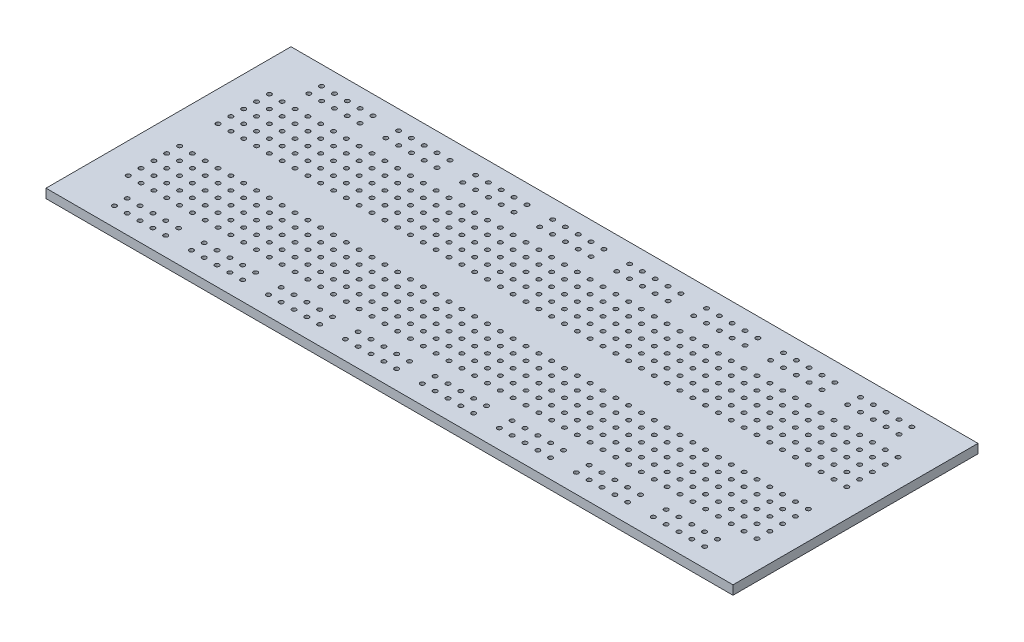
from build123d import *

# Parameters (mm, degrees)
CROQUIS1_W              = 136
CROQUIS1_H              = 48.5
CROQUIS1_R              = 0.425
SALIENTE_EXTRUIR1_DEPTH = 1.8


with BuildPart() as part:
    # Croquis1 → Saliente-Extruir1 (new body)
    with BuildSketch(Plane(origin=(0, 0, 0), x_dir=(1, 0, 0), z_dir=(0, 1, 0))):
        with Locations((68, 24.25)):
            Rectangle(CROQUIS1_W, CROQUIS1_H)
        with Locations((6, 28.06)):
            Circle(CROQUIS1_R, mode=Mode.SUBTRACT)
        with Locations((8.54, 28.06)):
            Circle(CROQUIS1_R, mode=Mode.SUBTRACT)
        with Locations((11.08, 28.06)):
            Circle(CROQUIS1_R, mode=Mode.SUBTRACT)
        with Locations((13.62, 28.06)):
            Circle(CROQUIS1_R, mode=Mode.SUBTRACT)
        with Locations((16.16, 28.06)):
            Circle(CROQUIS1_R, mode=Mode.SUBTRACT)
        with Locations((18.7, 28.06)):
            Circle(CROQUIS1_R, mode=Mode.SUBTRACT)
        with Locations((21.24, 28.06)):
            Circle(CROQUIS1_R, mode=Mode.SUBTRACT)
        with Locations((23.78, 28.06)):
            Circle(CROQUIS1_R, mode=Mode.SUBTRACT)
        with Locations((26.32, 28.06)):
            Circle(CROQUIS1_R, mode=Mode.SUBTRACT)
        with Locations((28.86, 28.06)):
            Circle(CROQUIS1_R, mode=Mode.SUBTRACT)
        with Locations((31.4, 28.06)):
            Circle(CROQUIS1_R, mode=Mode.SUBTRACT)
        with Locations((33.94, 28.06)):
            Circle(CROQUIS1_R, mode=Mode.SUBTRACT)
        with Locations((36.48, 28.06)):
            Circle(CROQUIS1_R, mode=Mode.SUBTRACT)
        with Locations((39.02, 28.06)):
            Circle(CROQUIS1_R, mode=Mode.SUBTRACT)
        with Locations((41.56, 28.06)):
            Circle(CROQUIS1_R, mode=Mode.SUBTRACT)
        with Locations((44.1, 28.06)):
            Circle(CROQUIS1_R, mode=Mode.SUBTRACT)
        with Locations((46.64, 28.06)):
            Circle(CROQUIS1_R, mode=Mode.SUBTRACT)
        with Locations((49.18, 28.06)):
            Circle(CROQUIS1_R, mode=Mode.SUBTRACT)
        with Locations((51.72, 28.06)):
            Circle(CROQUIS1_R, mode=Mode.SUBTRACT)
        with Locations((54.26, 28.06)):
            Circle(CROQUIS1_R, mode=Mode.SUBTRACT)
        with Locations((56.8, 28.06)):
            Circle(CROQUIS1_R, mode=Mode.SUBTRACT)
        with Locations((59.34, 28.06)):
            Circle(CROQUIS1_R, mode=Mode.SUBTRACT)
        with Locations((61.88, 28.06)):
            Circle(CROQUIS1_R, mode=Mode.SUBTRACT)
        with Locations((64.42, 28.06)):
            Circle(CROQUIS1_R, mode=Mode.SUBTRACT)
        with Locations((66.96, 28.06)):
            Circle(CROQUIS1_R, mode=Mode.SUBTRACT)
        with Locations((69.5, 28.06)):
            Circle(CROQUIS1_R, mode=Mode.SUBTRACT)
        with Locations((72.04, 28.06)):
            Circle(CROQUIS1_R, mode=Mode.SUBTRACT)
        with Locations((74.58, 28.06)):
            Circle(CROQUIS1_R, mode=Mode.SUBTRACT)
        with Locations((77.12, 28.06)):
            Circle(CROQUIS1_R, mode=Mode.SUBTRACT)
        with Locations((79.66, 28.06)):
            Circle(CROQUIS1_R, mode=Mode.SUBTRACT)
        with Locations((82.2, 28.06)):
            Circle(CROQUIS1_R, mode=Mode.SUBTRACT)
        with Locations((84.74, 28.06)):
            Circle(CROQUIS1_R, mode=Mode.SUBTRACT)
        with Locations((87.28, 28.06)):
            Circle(CROQUIS1_R, mode=Mode.SUBTRACT)
        with Locations((89.82, 28.06)):
            Circle(CROQUIS1_R, mode=Mode.SUBTRACT)
        with Locations((92.36, 28.06)):
            Circle(CROQUIS1_R, mode=Mode.SUBTRACT)
        with Locations((94.9, 28.06)):
            Circle(CROQUIS1_R, mode=Mode.SUBTRACT)
        with Locations((97.44, 28.06)):
            Circle(CROQUIS1_R, mode=Mode.SUBTRACT)
        with Locations((99.98, 28.06)):
            Circle(CROQUIS1_R, mode=Mode.SUBTRACT)
        with Locations((102.52, 28.06)):
            Circle(CROQUIS1_R, mode=Mode.SUBTRACT)
        with Locations((105.06, 28.06)):
            Circle(CROQUIS1_R, mode=Mode.SUBTRACT)
        with Locations((107.6, 28.06)):
            Circle(CROQUIS1_R, mode=Mode.SUBTRACT)
        with Locations((110.14, 28.06)):
            Circle(CROQUIS1_R, mode=Mode.SUBTRACT)
        with Locations((112.68, 28.06)):
            Circle(CROQUIS1_R, mode=Mode.SUBTRACT)
        with Locations((115.22, 28.06)):
            Circle(CROQUIS1_R, mode=Mode.SUBTRACT)
        with Locations((117.76, 28.06)):
            Circle(CROQUIS1_R, mode=Mode.SUBTRACT)
        with Locations((120.3, 28.06)):
            Circle(CROQUIS1_R, mode=Mode.SUBTRACT)
        with Locations((122.84, 28.06)):
            Circle(CROQUIS1_R, mode=Mode.SUBTRACT)
        with Locations((125.38, 28.06)):
            Circle(CROQUIS1_R, mode=Mode.SUBTRACT)
        with Locations((127.92, 28.06)):
            Circle(CROQUIS1_R, mode=Mode.SUBTRACT)
        with Locations((130.46, 28.06)):
            Circle(CROQUIS1_R, mode=Mode.SUBTRACT)
        with Locations((8.54, 30.6)):
            Circle(CROQUIS1_R, mode=Mode.SUBTRACT)
        with Locations((11.08, 30.6)):
            Circle(CROQUIS1_R, mode=Mode.SUBTRACT)
        with Locations((13.62, 30.6)):
            Circle(CROQUIS1_R, mode=Mode.SUBTRACT)
        with Locations((16.16, 30.6)):
            Circle(CROQUIS1_R, mode=Mode.SUBTRACT)
        with Locations((18.7, 30.6)):
            Circle(CROQUIS1_R, mode=Mode.SUBTRACT)
        with Locations((21.24, 30.6)):
            Circle(CROQUIS1_R, mode=Mode.SUBTRACT)
        with Locations((23.78, 30.6)):
            Circle(CROQUIS1_R, mode=Mode.SUBTRACT)
        with Locations((26.32, 30.6)):
            Circle(CROQUIS1_R, mode=Mode.SUBTRACT)
        with Locations((28.86, 30.6)):
            Circle(CROQUIS1_R, mode=Mode.SUBTRACT)
        with Locations((31.4, 30.6)):
            Circle(CROQUIS1_R, mode=Mode.SUBTRACT)
        with Locations((33.94, 30.6)):
            Circle(CROQUIS1_R, mode=Mode.SUBTRACT)
        with Locations((36.48, 30.6)):
            Circle(CROQUIS1_R, mode=Mode.SUBTRACT)
        with Locations((39.02, 30.6)):
            Circle(CROQUIS1_R, mode=Mode.SUBTRACT)
        with Locations((41.56, 30.6)):
            Circle(CROQUIS1_R, mode=Mode.SUBTRACT)
        with Locations((44.1, 30.6)):
            Circle(CROQUIS1_R, mode=Mode.SUBTRACT)
        with Locations((46.64, 30.6)):
            Circle(CROQUIS1_R, mode=Mode.SUBTRACT)
        with Locations((49.18, 30.6)):
            Circle(CROQUIS1_R, mode=Mode.SUBTRACT)
        with Locations((51.72, 30.6)):
            Circle(CROQUIS1_R, mode=Mode.SUBTRACT)
        with Locations((54.26, 30.6)):
            Circle(CROQUIS1_R, mode=Mode.SUBTRACT)
        with Locations((56.8, 30.6)):
            Circle(CROQUIS1_R, mode=Mode.SUBTRACT)
        with Locations((59.34, 30.6)):
            Circle(CROQUIS1_R, mode=Mode.SUBTRACT)
        with Locations((61.88, 30.6)):
            Circle(CROQUIS1_R, mode=Mode.SUBTRACT)
        with Locations((64.42, 30.6)):
            Circle(CROQUIS1_R, mode=Mode.SUBTRACT)
        with Locations((66.96, 30.6)):
            Circle(CROQUIS1_R, mode=Mode.SUBTRACT)
        with Locations((69.5, 30.6)):
            Circle(CROQUIS1_R, mode=Mode.SUBTRACT)
        with Locations((72.04, 30.6)):
            Circle(CROQUIS1_R, mode=Mode.SUBTRACT)
        with Locations((74.58, 30.6)):
            Circle(CROQUIS1_R, mode=Mode.SUBTRACT)
        with Locations((77.12, 30.6)):
            Circle(CROQUIS1_R, mode=Mode.SUBTRACT)
        with Locations((79.66, 30.6)):
            Circle(CROQUIS1_R, mode=Mode.SUBTRACT)
        with Locations((82.2, 30.6)):
            Circle(CROQUIS1_R, mode=Mode.SUBTRACT)
        with Locations((84.74, 30.6)):
            Circle(CROQUIS1_R, mode=Mode.SUBTRACT)
        with Locations((87.28, 30.6)):
            Circle(CROQUIS1_R, mode=Mode.SUBTRACT)
        with Locations((89.82, 30.6)):
            Circle(CROQUIS1_R, mode=Mode.SUBTRACT)
        with Locations((92.36, 30.6)):
            Circle(CROQUIS1_R, mode=Mode.SUBTRACT)
        with Locations((94.9, 30.6)):
            Circle(CROQUIS1_R, mode=Mode.SUBTRACT)
        with Locations((97.44, 30.6)):
            Circle(CROQUIS1_R, mode=Mode.SUBTRACT)
        with Locations((99.98, 30.6)):
            Circle(CROQUIS1_R, mode=Mode.SUBTRACT)
        with Locations((102.52, 30.6)):
            Circle(CROQUIS1_R, mode=Mode.SUBTRACT)
        with Locations((105.06, 30.6)):
            Circle(CROQUIS1_R, mode=Mode.SUBTRACT)
        with Locations((107.6, 30.6)):
            Circle(CROQUIS1_R, mode=Mode.SUBTRACT)
        with Locations((110.14, 30.6)):
            Circle(CROQUIS1_R, mode=Mode.SUBTRACT)
        with Locations((112.68, 30.6)):
            Circle(CROQUIS1_R, mode=Mode.SUBTRACT)
        with Locations((115.22, 30.6)):
            Circle(CROQUIS1_R, mode=Mode.SUBTRACT)
        with Locations((117.76, 30.6)):
            Circle(CROQUIS1_R, mode=Mode.SUBTRACT)
        with Locations((120.3, 30.6)):
            Circle(CROQUIS1_R, mode=Mode.SUBTRACT)
        with Locations((122.84, 30.6)):
            Circle(CROQUIS1_R, mode=Mode.SUBTRACT)
        with Locations((125.38, 30.6)):
            Circle(CROQUIS1_R, mode=Mode.SUBTRACT)
        with Locations((127.92, 30.6)):
            Circle(CROQUIS1_R, mode=Mode.SUBTRACT)
        with Locations((130.46, 30.6)):
            Circle(CROQUIS1_R, mode=Mode.SUBTRACT)
        with Locations((8.54, 33.14)):
            Circle(CROQUIS1_R, mode=Mode.SUBTRACT)
        with Locations((11.08, 33.14)):
            Circle(CROQUIS1_R, mode=Mode.SUBTRACT)
        with Locations((13.62, 33.14)):
            Circle(CROQUIS1_R, mode=Mode.SUBTRACT)
        with Locations((16.16, 33.14)):
            Circle(CROQUIS1_R, mode=Mode.SUBTRACT)
        with Locations((18.7, 33.14)):
            Circle(CROQUIS1_R, mode=Mode.SUBTRACT)
        with Locations((21.24, 33.14)):
            Circle(CROQUIS1_R, mode=Mode.SUBTRACT)
        with Locations((23.78, 33.14)):
            Circle(CROQUIS1_R, mode=Mode.SUBTRACT)
        with Locations((26.32, 33.14)):
            Circle(CROQUIS1_R, mode=Mode.SUBTRACT)
        with Locations((28.86, 33.14)):
            Circle(CROQUIS1_R, mode=Mode.SUBTRACT)
        with Locations((31.4, 33.14)):
            Circle(CROQUIS1_R, mode=Mode.SUBTRACT)
        with Locations((33.94, 33.14)):
            Circle(CROQUIS1_R, mode=Mode.SUBTRACT)
        with Locations((36.48, 33.14)):
            Circle(CROQUIS1_R, mode=Mode.SUBTRACT)
        with Locations((39.02, 33.14)):
            Circle(CROQUIS1_R, mode=Mode.SUBTRACT)
        with Locations((41.56, 33.14)):
            Circle(CROQUIS1_R, mode=Mode.SUBTRACT)
        with Locations((44.1, 33.14)):
            Circle(CROQUIS1_R, mode=Mode.SUBTRACT)
        with Locations((46.64, 33.14)):
            Circle(CROQUIS1_R, mode=Mode.SUBTRACT)
        with Locations((49.18, 33.14)):
            Circle(CROQUIS1_R, mode=Mode.SUBTRACT)
        with Locations((51.72, 33.14)):
            Circle(CROQUIS1_R, mode=Mode.SUBTRACT)
        with Locations((54.26, 33.14)):
            Circle(CROQUIS1_R, mode=Mode.SUBTRACT)
        with Locations((56.8, 33.14)):
            Circle(CROQUIS1_R, mode=Mode.SUBTRACT)
        with Locations((59.34, 33.14)):
            Circle(CROQUIS1_R, mode=Mode.SUBTRACT)
        with Locations((61.88, 33.14)):
            Circle(CROQUIS1_R, mode=Mode.SUBTRACT)
        with Locations((64.42, 33.14)):
            Circle(CROQUIS1_R, mode=Mode.SUBTRACT)
        with Locations((66.96, 33.14)):
            Circle(CROQUIS1_R, mode=Mode.SUBTRACT)
        with Locations((69.5, 33.14)):
            Circle(CROQUIS1_R, mode=Mode.SUBTRACT)
        with Locations((72.04, 33.14)):
            Circle(CROQUIS1_R, mode=Mode.SUBTRACT)
        with Locations((74.58, 33.14)):
            Circle(CROQUIS1_R, mode=Mode.SUBTRACT)
        with Locations((77.12, 33.14)):
            Circle(CROQUIS1_R, mode=Mode.SUBTRACT)
        with Locations((79.66, 33.14)):
            Circle(CROQUIS1_R, mode=Mode.SUBTRACT)
        with Locations((82.2, 33.14)):
            Circle(CROQUIS1_R, mode=Mode.SUBTRACT)
        with Locations((84.74, 33.14)):
            Circle(CROQUIS1_R, mode=Mode.SUBTRACT)
        with Locations((87.28, 33.14)):
            Circle(CROQUIS1_R, mode=Mode.SUBTRACT)
        with Locations((89.82, 33.14)):
            Circle(CROQUIS1_R, mode=Mode.SUBTRACT)
        with Locations((92.36, 33.14)):
            Circle(CROQUIS1_R, mode=Mode.SUBTRACT)
        with Locations((94.9, 33.14)):
            Circle(CROQUIS1_R, mode=Mode.SUBTRACT)
        with Locations((97.44, 33.14)):
            Circle(CROQUIS1_R, mode=Mode.SUBTRACT)
        with Locations((99.98, 33.14)):
            Circle(CROQUIS1_R, mode=Mode.SUBTRACT)
        with Locations((102.52, 33.14)):
            Circle(CROQUIS1_R, mode=Mode.SUBTRACT)
        with Locations((105.06, 33.14)):
            Circle(CROQUIS1_R, mode=Mode.SUBTRACT)
        with Locations((107.6, 33.14)):
            Circle(CROQUIS1_R, mode=Mode.SUBTRACT)
        with Locations((110.14, 33.14)):
            Circle(CROQUIS1_R, mode=Mode.SUBTRACT)
        with Locations((112.68, 33.14)):
            Circle(CROQUIS1_R, mode=Mode.SUBTRACT)
        with Locations((115.22, 33.14)):
            Circle(CROQUIS1_R, mode=Mode.SUBTRACT)
        with Locations((117.76, 33.14)):
            Circle(CROQUIS1_R, mode=Mode.SUBTRACT)
        with Locations((120.3, 33.14)):
            Circle(CROQUIS1_R, mode=Mode.SUBTRACT)
        with Locations((122.84, 33.14)):
            Circle(CROQUIS1_R, mode=Mode.SUBTRACT)
        with Locations((125.38, 33.14)):
            Circle(CROQUIS1_R, mode=Mode.SUBTRACT)
        with Locations((127.92, 33.14)):
            Circle(CROQUIS1_R, mode=Mode.SUBTRACT)
        with Locations((130.46, 33.14)):
            Circle(CROQUIS1_R, mode=Mode.SUBTRACT)
        with Locations((8.54, 35.68)):
            Circle(CROQUIS1_R, mode=Mode.SUBTRACT)
        with Locations((11.08, 35.68)):
            Circle(CROQUIS1_R, mode=Mode.SUBTRACT)
        with Locations((13.62, 35.68)):
            Circle(CROQUIS1_R, mode=Mode.SUBTRACT)
        with Locations((16.16, 35.68)):
            Circle(CROQUIS1_R, mode=Mode.SUBTRACT)
        with Locations((18.7, 35.68)):
            Circle(CROQUIS1_R, mode=Mode.SUBTRACT)
        with Locations((21.24, 35.68)):
            Circle(CROQUIS1_R, mode=Mode.SUBTRACT)
        with Locations((23.78, 35.68)):
            Circle(CROQUIS1_R, mode=Mode.SUBTRACT)
        with Locations((26.32, 35.68)):
            Circle(CROQUIS1_R, mode=Mode.SUBTRACT)
        with Locations((28.86, 35.68)):
            Circle(CROQUIS1_R, mode=Mode.SUBTRACT)
        with Locations((31.4, 35.68)):
            Circle(CROQUIS1_R, mode=Mode.SUBTRACT)
        with Locations((33.94, 35.68)):
            Circle(CROQUIS1_R, mode=Mode.SUBTRACT)
        with Locations((36.48, 35.68)):
            Circle(CROQUIS1_R, mode=Mode.SUBTRACT)
        with Locations((39.02, 35.68)):
            Circle(CROQUIS1_R, mode=Mode.SUBTRACT)
        with Locations((41.56, 35.68)):
            Circle(CROQUIS1_R, mode=Mode.SUBTRACT)
        with Locations((44.1, 35.68)):
            Circle(CROQUIS1_R, mode=Mode.SUBTRACT)
        with Locations((46.64, 35.68)):
            Circle(CROQUIS1_R, mode=Mode.SUBTRACT)
        with Locations((49.18, 35.68)):
            Circle(CROQUIS1_R, mode=Mode.SUBTRACT)
        with Locations((51.72, 35.68)):
            Circle(CROQUIS1_R, mode=Mode.SUBTRACT)
        with Locations((54.26, 35.68)):
            Circle(CROQUIS1_R, mode=Mode.SUBTRACT)
        with Locations((56.8, 35.68)):
            Circle(CROQUIS1_R, mode=Mode.SUBTRACT)
        with Locations((59.34, 35.68)):
            Circle(CROQUIS1_R, mode=Mode.SUBTRACT)
        with Locations((61.88, 35.68)):
            Circle(CROQUIS1_R, mode=Mode.SUBTRACT)
        with Locations((64.42, 35.68)):
            Circle(CROQUIS1_R, mode=Mode.SUBTRACT)
        with Locations((66.96, 35.68)):
            Circle(CROQUIS1_R, mode=Mode.SUBTRACT)
        with Locations((69.5, 35.68)):
            Circle(CROQUIS1_R, mode=Mode.SUBTRACT)
        with Locations((72.04, 35.68)):
            Circle(CROQUIS1_R, mode=Mode.SUBTRACT)
        with Locations((74.58, 35.68)):
            Circle(CROQUIS1_R, mode=Mode.SUBTRACT)
        with Locations((77.12, 35.68)):
            Circle(CROQUIS1_R, mode=Mode.SUBTRACT)
        with Locations((79.66, 35.68)):
            Circle(CROQUIS1_R, mode=Mode.SUBTRACT)
        with Locations((82.2, 35.68)):
            Circle(CROQUIS1_R, mode=Mode.SUBTRACT)
        with Locations((84.74, 35.68)):
            Circle(CROQUIS1_R, mode=Mode.SUBTRACT)
        with Locations((87.28, 35.68)):
            Circle(CROQUIS1_R, mode=Mode.SUBTRACT)
        with Locations((89.82, 35.68)):
            Circle(CROQUIS1_R, mode=Mode.SUBTRACT)
        with Locations((92.36, 35.68)):
            Circle(CROQUIS1_R, mode=Mode.SUBTRACT)
        with Locations((94.9, 35.68)):
            Circle(CROQUIS1_R, mode=Mode.SUBTRACT)
        with Locations((97.44, 35.68)):
            Circle(CROQUIS1_R, mode=Mode.SUBTRACT)
        with Locations((99.98, 35.68)):
            Circle(CROQUIS1_R, mode=Mode.SUBTRACT)
        with Locations((102.52, 35.68)):
            Circle(CROQUIS1_R, mode=Mode.SUBTRACT)
        with Locations((105.06, 35.68)):
            Circle(CROQUIS1_R, mode=Mode.SUBTRACT)
        with Locations((107.6, 35.68)):
            Circle(CROQUIS1_R, mode=Mode.SUBTRACT)
        with Locations((110.14, 35.68)):
            Circle(CROQUIS1_R, mode=Mode.SUBTRACT)
        with Locations((112.68, 35.68)):
            Circle(CROQUIS1_R, mode=Mode.SUBTRACT)
        with Locations((115.22, 35.68)):
            Circle(CROQUIS1_R, mode=Mode.SUBTRACT)
        with Locations((117.76, 35.68)):
            Circle(CROQUIS1_R, mode=Mode.SUBTRACT)
        with Locations((120.3, 35.68)):
            Circle(CROQUIS1_R, mode=Mode.SUBTRACT)
        with Locations((122.84, 35.68)):
            Circle(CROQUIS1_R, mode=Mode.SUBTRACT)
        with Locations((125.38, 35.68)):
            Circle(CROQUIS1_R, mode=Mode.SUBTRACT)
        with Locations((127.92, 35.68)):
            Circle(CROQUIS1_R, mode=Mode.SUBTRACT)
        with Locations((130.46, 35.68)):
            Circle(CROQUIS1_R, mode=Mode.SUBTRACT)
        with Locations((8.54, 38.22)):
            Circle(CROQUIS1_R, mode=Mode.SUBTRACT)
        with Locations((11.08, 38.22)):
            Circle(CROQUIS1_R, mode=Mode.SUBTRACT)
        with Locations((13.62, 38.22)):
            Circle(CROQUIS1_R, mode=Mode.SUBTRACT)
        with Locations((16.16, 38.22)):
            Circle(CROQUIS1_R, mode=Mode.SUBTRACT)
        with Locations((18.7, 38.22)):
            Circle(CROQUIS1_R, mode=Mode.SUBTRACT)
        with Locations((21.24, 38.22)):
            Circle(CROQUIS1_R, mode=Mode.SUBTRACT)
        with Locations((23.78, 38.22)):
            Circle(CROQUIS1_R, mode=Mode.SUBTRACT)
        with Locations((26.32, 38.22)):
            Circle(CROQUIS1_R, mode=Mode.SUBTRACT)
        with Locations((28.86, 38.22)):
            Circle(CROQUIS1_R, mode=Mode.SUBTRACT)
        with Locations((31.4, 38.22)):
            Circle(CROQUIS1_R, mode=Mode.SUBTRACT)
        with Locations((33.94, 38.22)):
            Circle(CROQUIS1_R, mode=Mode.SUBTRACT)
        with Locations((36.48, 38.22)):
            Circle(CROQUIS1_R, mode=Mode.SUBTRACT)
        with Locations((39.02, 38.22)):
            Circle(CROQUIS1_R, mode=Mode.SUBTRACT)
        with Locations((41.56, 38.22)):
            Circle(CROQUIS1_R, mode=Mode.SUBTRACT)
        with Locations((44.1, 38.22)):
            Circle(CROQUIS1_R, mode=Mode.SUBTRACT)
        with Locations((46.64, 38.22)):
            Circle(CROQUIS1_R, mode=Mode.SUBTRACT)
        with Locations((49.18, 38.22)):
            Circle(CROQUIS1_R, mode=Mode.SUBTRACT)
        with Locations((51.72, 38.22)):
            Circle(CROQUIS1_R, mode=Mode.SUBTRACT)
        with Locations((54.26, 38.22)):
            Circle(CROQUIS1_R, mode=Mode.SUBTRACT)
        with Locations((56.8, 38.22)):
            Circle(CROQUIS1_R, mode=Mode.SUBTRACT)
        with Locations((59.34, 38.22)):
            Circle(CROQUIS1_R, mode=Mode.SUBTRACT)
        with Locations((61.88, 38.22)):
            Circle(CROQUIS1_R, mode=Mode.SUBTRACT)
        with Locations((64.42, 38.22)):
            Circle(CROQUIS1_R, mode=Mode.SUBTRACT)
        with Locations((66.96, 38.22)):
            Circle(CROQUIS1_R, mode=Mode.SUBTRACT)
        with Locations((69.5, 38.22)):
            Circle(CROQUIS1_R, mode=Mode.SUBTRACT)
        with Locations((72.04, 38.22)):
            Circle(CROQUIS1_R, mode=Mode.SUBTRACT)
        with Locations((74.58, 38.22)):
            Circle(CROQUIS1_R, mode=Mode.SUBTRACT)
        with Locations((77.12, 38.22)):
            Circle(CROQUIS1_R, mode=Mode.SUBTRACT)
        with Locations((79.66, 38.22)):
            Circle(CROQUIS1_R, mode=Mode.SUBTRACT)
        with Locations((82.2, 38.22)):
            Circle(CROQUIS1_R, mode=Mode.SUBTRACT)
        with Locations((84.74, 38.22)):
            Circle(CROQUIS1_R, mode=Mode.SUBTRACT)
        with Locations((87.28, 38.22)):
            Circle(CROQUIS1_R, mode=Mode.SUBTRACT)
        with Locations((89.82, 38.22)):
            Circle(CROQUIS1_R, mode=Mode.SUBTRACT)
        with Locations((92.36, 38.22)):
            Circle(CROQUIS1_R, mode=Mode.SUBTRACT)
        with Locations((94.9, 38.22)):
            Circle(CROQUIS1_R, mode=Mode.SUBTRACT)
        with Locations((97.44, 38.22)):
            Circle(CROQUIS1_R, mode=Mode.SUBTRACT)
        with Locations((99.98, 38.22)):
            Circle(CROQUIS1_R, mode=Mode.SUBTRACT)
        with Locations((102.52, 38.22)):
            Circle(CROQUIS1_R, mode=Mode.SUBTRACT)
        with Locations((105.06, 38.22)):
            Circle(CROQUIS1_R, mode=Mode.SUBTRACT)
        with Locations((107.6, 38.22)):
            Circle(CROQUIS1_R, mode=Mode.SUBTRACT)
        with Locations((110.14, 38.22)):
            Circle(CROQUIS1_R, mode=Mode.SUBTRACT)
        with Locations((112.68, 38.22)):
            Circle(CROQUIS1_R, mode=Mode.SUBTRACT)
        with Locations((115.22, 38.22)):
            Circle(CROQUIS1_R, mode=Mode.SUBTRACT)
        with Locations((117.76, 38.22)):
            Circle(CROQUIS1_R, mode=Mode.SUBTRACT)
        with Locations((120.3, 38.22)):
            Circle(CROQUIS1_R, mode=Mode.SUBTRACT)
        with Locations((122.84, 38.22)):
            Circle(CROQUIS1_R, mode=Mode.SUBTRACT)
        with Locations((125.38, 38.22)):
            Circle(CROQUIS1_R, mode=Mode.SUBTRACT)
        with Locations((127.92, 38.22)):
            Circle(CROQUIS1_R, mode=Mode.SUBTRACT)
        with Locations((130.46, 38.22)):
            Circle(CROQUIS1_R, mode=Mode.SUBTRACT)
        with Locations((6, 30.6)):
            Circle(CROQUIS1_R, mode=Mode.SUBTRACT)
        with Locations((6, 33.14)):
            Circle(CROQUIS1_R, mode=Mode.SUBTRACT)
        with Locations((6, 35.68)):
            Circle(CROQUIS1_R, mode=Mode.SUBTRACT)
        with Locations((6, 38.22)):
            Circle(CROQUIS1_R, mode=Mode.SUBTRACT)
        with Locations((9.8, 42.22)):
            Circle(CROQUIS1_R, mode=Mode.SUBTRACT)
        with Locations((12.34, 42.22)):
            Circle(CROQUIS1_R, mode=Mode.SUBTRACT)
        with Locations((14.88, 42.22)):
            Circle(CROQUIS1_R, mode=Mode.SUBTRACT)
        with Locations((17.42, 42.22)):
            Circle(CROQUIS1_R, mode=Mode.SUBTRACT)
        with Locations((19.96, 42.22)):
            Circle(CROQUIS1_R, mode=Mode.SUBTRACT)
        with Locations((12.34, 44.76)):
            Circle(CROQUIS1_R, mode=Mode.SUBTRACT)
        with Locations((14.88, 44.76)):
            Circle(CROQUIS1_R, mode=Mode.SUBTRACT)
        with Locations((17.42, 44.76)):
            Circle(CROQUIS1_R, mode=Mode.SUBTRACT)
        with Locations((19.96, 44.76)):
            Circle(CROQUIS1_R, mode=Mode.SUBTRACT)
        with Locations((9.8, 44.76)):
            Circle(CROQUIS1_R, mode=Mode.SUBTRACT)
        with Locations((25.04, 44.76)):
            Circle(CROQUIS1_R, mode=Mode.SUBTRACT)
        with Locations((27.58, 44.76)):
            Circle(CROQUIS1_R, mode=Mode.SUBTRACT)
        with Locations((30.12, 44.76)):
            Circle(CROQUIS1_R, mode=Mode.SUBTRACT)
        with Locations((32.66, 44.76)):
            Circle(CROQUIS1_R, mode=Mode.SUBTRACT)
        with Locations((35.2, 44.76)):
            Circle(CROQUIS1_R, mode=Mode.SUBTRACT)
        with Locations((35.2, 42.22)):
            Circle(CROQUIS1_R, mode=Mode.SUBTRACT)
        with Locations((32.66, 42.22)):
            Circle(CROQUIS1_R, mode=Mode.SUBTRACT)
        with Locations((30.12, 42.22)):
            Circle(CROQUIS1_R, mode=Mode.SUBTRACT)
        with Locations((27.58, 42.22)):
            Circle(CROQUIS1_R, mode=Mode.SUBTRACT)
        with Locations((25.04, 42.22)):
            Circle(CROQUIS1_R, mode=Mode.SUBTRACT)
        with Locations((40.28, 44.76)):
            Circle(CROQUIS1_R, mode=Mode.SUBTRACT)
        with Locations((42.82, 44.76)):
            Circle(CROQUIS1_R, mode=Mode.SUBTRACT)
        with Locations((45.36, 44.76)):
            Circle(CROQUIS1_R, mode=Mode.SUBTRACT)
        with Locations((47.9, 44.76)):
            Circle(CROQUIS1_R, mode=Mode.SUBTRACT)
        with Locations((50.44, 44.76)):
            Circle(CROQUIS1_R, mode=Mode.SUBTRACT)
        with Locations((50.44, 42.22)):
            Circle(CROQUIS1_R, mode=Mode.SUBTRACT)
        with Locations((47.9, 42.22)):
            Circle(CROQUIS1_R, mode=Mode.SUBTRACT)
        with Locations((45.36, 42.22)):
            Circle(CROQUIS1_R, mode=Mode.SUBTRACT)
        with Locations((42.82, 42.22)):
            Circle(CROQUIS1_R, mode=Mode.SUBTRACT)
        with Locations((40.28, 42.22)):
            Circle(CROQUIS1_R, mode=Mode.SUBTRACT)
        with Locations((55.52, 44.76)):
            Circle(CROQUIS1_R, mode=Mode.SUBTRACT)
        with Locations((58.06, 44.76)):
            Circle(CROQUIS1_R, mode=Mode.SUBTRACT)
        with Locations((60.6, 44.76)):
            Circle(CROQUIS1_R, mode=Mode.SUBTRACT)
        with Locations((63.14, 44.76)):
            Circle(CROQUIS1_R, mode=Mode.SUBTRACT)
        with Locations((65.68, 44.76)):
            Circle(CROQUIS1_R, mode=Mode.SUBTRACT)
        with Locations((65.68, 42.22)):
            Circle(CROQUIS1_R, mode=Mode.SUBTRACT)
        with Locations((63.14, 42.22)):
            Circle(CROQUIS1_R, mode=Mode.SUBTRACT)
        with Locations((60.6, 42.22)):
            Circle(CROQUIS1_R, mode=Mode.SUBTRACT)
        with Locations((58.06, 42.22)):
            Circle(CROQUIS1_R, mode=Mode.SUBTRACT)
        with Locations((55.52, 42.22)):
            Circle(CROQUIS1_R, mode=Mode.SUBTRACT)
        with Locations((70.76, 44.76)):
            Circle(CROQUIS1_R, mode=Mode.SUBTRACT)
        with Locations((73.3, 44.76)):
            Circle(CROQUIS1_R, mode=Mode.SUBTRACT)
        with Locations((75.84, 44.76)):
            Circle(CROQUIS1_R, mode=Mode.SUBTRACT)
        with Locations((78.38, 44.76)):
            Circle(CROQUIS1_R, mode=Mode.SUBTRACT)
        with Locations((80.92, 44.76)):
            Circle(CROQUIS1_R, mode=Mode.SUBTRACT)
        with Locations((80.92, 42.22)):
            Circle(CROQUIS1_R, mode=Mode.SUBTRACT)
        with Locations((78.38, 42.22)):
            Circle(CROQUIS1_R, mode=Mode.SUBTRACT)
        with Locations((75.84, 42.22)):
            Circle(CROQUIS1_R, mode=Mode.SUBTRACT)
        with Locations((73.3, 42.22)):
            Circle(CROQUIS1_R, mode=Mode.SUBTRACT)
        with Locations((70.76, 42.22)):
            Circle(CROQUIS1_R, mode=Mode.SUBTRACT)
        with Locations((86, 44.76)):
            Circle(CROQUIS1_R, mode=Mode.SUBTRACT)
        with Locations((88.54, 44.76)):
            Circle(CROQUIS1_R, mode=Mode.SUBTRACT)
        with Locations((91.08, 44.76)):
            Circle(CROQUIS1_R, mode=Mode.SUBTRACT)
        with Locations((93.62, 44.76)):
            Circle(CROQUIS1_R, mode=Mode.SUBTRACT)
        with Locations((96.16, 44.76)):
            Circle(CROQUIS1_R, mode=Mode.SUBTRACT)
        with Locations((96.16, 42.22)):
            Circle(CROQUIS1_R, mode=Mode.SUBTRACT)
        with Locations((93.62, 42.22)):
            Circle(CROQUIS1_R, mode=Mode.SUBTRACT)
        with Locations((91.08, 42.22)):
            Circle(CROQUIS1_R, mode=Mode.SUBTRACT)
        with Locations((88.54, 42.22)):
            Circle(CROQUIS1_R, mode=Mode.SUBTRACT)
        with Locations((86, 42.22)):
            Circle(CROQUIS1_R, mode=Mode.SUBTRACT)
        with Locations((101.24, 44.76)):
            Circle(CROQUIS1_R, mode=Mode.SUBTRACT)
        with Locations((103.78, 44.76)):
            Circle(CROQUIS1_R, mode=Mode.SUBTRACT)
        with Locations((106.32, 44.76)):
            Circle(CROQUIS1_R, mode=Mode.SUBTRACT)
        with Locations((108.86, 44.76)):
            Circle(CROQUIS1_R, mode=Mode.SUBTRACT)
        with Locations((111.4, 44.76)):
            Circle(CROQUIS1_R, mode=Mode.SUBTRACT)
        with Locations((111.4, 42.22)):
            Circle(CROQUIS1_R, mode=Mode.SUBTRACT)
        with Locations((108.86, 42.22)):
            Circle(CROQUIS1_R, mode=Mode.SUBTRACT)
        with Locations((106.32, 42.22)):
            Circle(CROQUIS1_R, mode=Mode.SUBTRACT)
        with Locations((103.78, 42.22)):
            Circle(CROQUIS1_R, mode=Mode.SUBTRACT)
        with Locations((101.24, 42.22)):
            Circle(CROQUIS1_R, mode=Mode.SUBTRACT)
        with Locations((116.48, 44.76)):
            Circle(CROQUIS1_R, mode=Mode.SUBTRACT)
        with Locations((119.02, 44.76)):
            Circle(CROQUIS1_R, mode=Mode.SUBTRACT)
        with Locations((121.56, 44.76)):
            Circle(CROQUIS1_R, mode=Mode.SUBTRACT)
        with Locations((124.1, 44.76)):
            Circle(CROQUIS1_R, mode=Mode.SUBTRACT)
        with Locations((126.64, 44.76)):
            Circle(CROQUIS1_R, mode=Mode.SUBTRACT)
        with Locations((126.64, 42.22)):
            Circle(CROQUIS1_R, mode=Mode.SUBTRACT)
        with Locations((124.1, 42.22)):
            Circle(CROQUIS1_R, mode=Mode.SUBTRACT)
        with Locations((121.56, 42.22)):
            Circle(CROQUIS1_R, mode=Mode.SUBTRACT)
        with Locations((119.02, 42.22)):
            Circle(CROQUIS1_R, mode=Mode.SUBTRACT)
        with Locations((116.48, 42.22)):
            Circle(CROQUIS1_R, mode=Mode.SUBTRACT)
        with Locations((116.48, 6.28)):
            Circle(CROQUIS1_R, mode=Mode.SUBTRACT)
        with Locations((119.02, 6.28)):
            Circle(CROQUIS1_R, mode=Mode.SUBTRACT)
        with Locations((121.56, 6.28)):
            Circle(CROQUIS1_R, mode=Mode.SUBTRACT)
        with Locations((124.1, 6.28)):
            Circle(CROQUIS1_R, mode=Mode.SUBTRACT)
        with Locations((126.64, 6.28)):
            Circle(CROQUIS1_R, mode=Mode.SUBTRACT)
        with Locations((126.64, 3.74)):
            Circle(CROQUIS1_R, mode=Mode.SUBTRACT)
        with Locations((124.1, 3.74)):
            Circle(CROQUIS1_R, mode=Mode.SUBTRACT)
        with Locations((121.56, 3.74)):
            Circle(CROQUIS1_R, mode=Mode.SUBTRACT)
        with Locations((119.02, 3.74)):
            Circle(CROQUIS1_R, mode=Mode.SUBTRACT)
        with Locations((116.48, 3.74)):
            Circle(CROQUIS1_R, mode=Mode.SUBTRACT)
        with Locations((101.24, 6.28)):
            Circle(CROQUIS1_R, mode=Mode.SUBTRACT)
        with Locations((103.78, 6.28)):
            Circle(CROQUIS1_R, mode=Mode.SUBTRACT)
        with Locations((106.32, 6.28)):
            Circle(CROQUIS1_R, mode=Mode.SUBTRACT)
        with Locations((108.86, 6.28)):
            Circle(CROQUIS1_R, mode=Mode.SUBTRACT)
        with Locations((111.4, 6.28)):
            Circle(CROQUIS1_R, mode=Mode.SUBTRACT)
        with Locations((111.4, 3.74)):
            Circle(CROQUIS1_R, mode=Mode.SUBTRACT)
        with Locations((108.86, 3.74)):
            Circle(CROQUIS1_R, mode=Mode.SUBTRACT)
        with Locations((106.32, 3.74)):
            Circle(CROQUIS1_R, mode=Mode.SUBTRACT)
        with Locations((103.78, 3.74)):
            Circle(CROQUIS1_R, mode=Mode.SUBTRACT)
        with Locations((101.24, 3.74)):
            Circle(CROQUIS1_R, mode=Mode.SUBTRACT)
        with Locations((86, 6.28)):
            Circle(CROQUIS1_R, mode=Mode.SUBTRACT)
        with Locations((88.54, 6.28)):
            Circle(CROQUIS1_R, mode=Mode.SUBTRACT)
        with Locations((91.08, 6.28)):
            Circle(CROQUIS1_R, mode=Mode.SUBTRACT)
        with Locations((93.62, 6.28)):
            Circle(CROQUIS1_R, mode=Mode.SUBTRACT)
        with Locations((96.16, 6.28)):
            Circle(CROQUIS1_R, mode=Mode.SUBTRACT)
        with Locations((96.16, 3.74)):
            Circle(CROQUIS1_R, mode=Mode.SUBTRACT)
        with Locations((93.62, 3.74)):
            Circle(CROQUIS1_R, mode=Mode.SUBTRACT)
        with Locations((91.08, 3.74)):
            Circle(CROQUIS1_R, mode=Mode.SUBTRACT)
        with Locations((88.54, 3.74)):
            Circle(CROQUIS1_R, mode=Mode.SUBTRACT)
        with Locations((86, 3.74)):
            Circle(CROQUIS1_R, mode=Mode.SUBTRACT)
        with Locations((70.76, 6.28)):
            Circle(CROQUIS1_R, mode=Mode.SUBTRACT)
        with Locations((73.3, 6.28)):
            Circle(CROQUIS1_R, mode=Mode.SUBTRACT)
        with Locations((75.84, 6.28)):
            Circle(CROQUIS1_R, mode=Mode.SUBTRACT)
        with Locations((78.38, 6.28)):
            Circle(CROQUIS1_R, mode=Mode.SUBTRACT)
        with Locations((80.92, 6.28)):
            Circle(CROQUIS1_R, mode=Mode.SUBTRACT)
        with Locations((80.92, 3.74)):
            Circle(CROQUIS1_R, mode=Mode.SUBTRACT)
        with Locations((78.38, 3.74)):
            Circle(CROQUIS1_R, mode=Mode.SUBTRACT)
        with Locations((75.84, 3.74)):
            Circle(CROQUIS1_R, mode=Mode.SUBTRACT)
        with Locations((73.3, 3.74)):
            Circle(CROQUIS1_R, mode=Mode.SUBTRACT)
        with Locations((70.76, 3.74)):
            Circle(CROQUIS1_R, mode=Mode.SUBTRACT)
        with Locations((55.52, 6.28)):
            Circle(CROQUIS1_R, mode=Mode.SUBTRACT)
        with Locations((58.06, 6.28)):
            Circle(CROQUIS1_R, mode=Mode.SUBTRACT)
        with Locations((60.6, 6.28)):
            Circle(CROQUIS1_R, mode=Mode.SUBTRACT)
        with Locations((63.14, 6.28)):
            Circle(CROQUIS1_R, mode=Mode.SUBTRACT)
        with Locations((65.68, 6.28)):
            Circle(CROQUIS1_R, mode=Mode.SUBTRACT)
        with Locations((65.68, 3.74)):
            Circle(CROQUIS1_R, mode=Mode.SUBTRACT)
        with Locations((63.14, 3.74)):
            Circle(CROQUIS1_R, mode=Mode.SUBTRACT)
        with Locations((60.6, 3.74)):
            Circle(CROQUIS1_R, mode=Mode.SUBTRACT)
        with Locations((58.06, 3.74)):
            Circle(CROQUIS1_R, mode=Mode.SUBTRACT)
        with Locations((55.52, 3.74)):
            Circle(CROQUIS1_R, mode=Mode.SUBTRACT)
        with Locations((40.28, 6.28)):
            Circle(CROQUIS1_R, mode=Mode.SUBTRACT)
        with Locations((42.82, 6.28)):
            Circle(CROQUIS1_R, mode=Mode.SUBTRACT)
        with Locations((45.36, 6.28)):
            Circle(CROQUIS1_R, mode=Mode.SUBTRACT)
        with Locations((47.9, 6.28)):
            Circle(CROQUIS1_R, mode=Mode.SUBTRACT)
        with Locations((50.44, 6.28)):
            Circle(CROQUIS1_R, mode=Mode.SUBTRACT)
        with Locations((50.44, 3.74)):
            Circle(CROQUIS1_R, mode=Mode.SUBTRACT)
        with Locations((47.9, 3.74)):
            Circle(CROQUIS1_R, mode=Mode.SUBTRACT)
        with Locations((45.36, 3.74)):
            Circle(CROQUIS1_R, mode=Mode.SUBTRACT)
        with Locations((42.82, 3.74)):
            Circle(CROQUIS1_R, mode=Mode.SUBTRACT)
        with Locations((40.28, 3.74)):
            Circle(CROQUIS1_R, mode=Mode.SUBTRACT)
        with Locations((25.04, 6.28)):
            Circle(CROQUIS1_R, mode=Mode.SUBTRACT)
        with Locations((27.58, 6.28)):
            Circle(CROQUIS1_R, mode=Mode.SUBTRACT)
        with Locations((30.12, 6.28)):
            Circle(CROQUIS1_R, mode=Mode.SUBTRACT)
        with Locations((32.66, 6.28)):
            Circle(CROQUIS1_R, mode=Mode.SUBTRACT)
        with Locations((35.2, 6.28)):
            Circle(CROQUIS1_R, mode=Mode.SUBTRACT)
        with Locations((35.2, 3.74)):
            Circle(CROQUIS1_R, mode=Mode.SUBTRACT)
        with Locations((32.66, 3.74)):
            Circle(CROQUIS1_R, mode=Mode.SUBTRACT)
        with Locations((30.12, 3.74)):
            Circle(CROQUIS1_R, mode=Mode.SUBTRACT)
        with Locations((27.58, 3.74)):
            Circle(CROQUIS1_R, mode=Mode.SUBTRACT)
        with Locations((25.04, 3.74)):
            Circle(CROQUIS1_R, mode=Mode.SUBTRACT)
        with Locations((9.8, 3.74)):
            Circle(CROQUIS1_R, mode=Mode.SUBTRACT)
        with Locations((19.96, 3.74)):
            Circle(CROQUIS1_R, mode=Mode.SUBTRACT)
        with Locations((17.42, 3.74)):
            Circle(CROQUIS1_R, mode=Mode.SUBTRACT)
        with Locations((14.88, 3.74)):
            Circle(CROQUIS1_R, mode=Mode.SUBTRACT)
        with Locations((12.34, 3.74)):
            Circle(CROQUIS1_R, mode=Mode.SUBTRACT)
        with Locations((19.96, 6.28)):
            Circle(CROQUIS1_R, mode=Mode.SUBTRACT)
        with Locations((17.42, 6.28)):
            Circle(CROQUIS1_R, mode=Mode.SUBTRACT)
        with Locations((14.88, 6.28)):
            Circle(CROQUIS1_R, mode=Mode.SUBTRACT)
        with Locations((12.34, 6.28)):
            Circle(CROQUIS1_R, mode=Mode.SUBTRACT)
        with Locations((9.8, 6.28)):
            Circle(CROQUIS1_R, mode=Mode.SUBTRACT)
        with Locations((6, 10.28)):
            Circle(CROQUIS1_R, mode=Mode.SUBTRACT)
        with Locations((6, 12.82)):
            Circle(CROQUIS1_R, mode=Mode.SUBTRACT)
        with Locations((6, 15.36)):
            Circle(CROQUIS1_R, mode=Mode.SUBTRACT)
        with Locations((6, 17.9)):
            Circle(CROQUIS1_R, mode=Mode.SUBTRACT)
        with Locations((130.46, 10.28)):
            Circle(CROQUIS1_R, mode=Mode.SUBTRACT)
        with Locations((127.92, 10.28)):
            Circle(CROQUIS1_R, mode=Mode.SUBTRACT)
        with Locations((125.38, 10.28)):
            Circle(CROQUIS1_R, mode=Mode.SUBTRACT)
        with Locations((122.84, 10.28)):
            Circle(CROQUIS1_R, mode=Mode.SUBTRACT)
        with Locations((120.3, 10.28)):
            Circle(CROQUIS1_R, mode=Mode.SUBTRACT)
        with Locations((117.76, 10.28)):
            Circle(CROQUIS1_R, mode=Mode.SUBTRACT)
        with Locations((115.22, 10.28)):
            Circle(CROQUIS1_R, mode=Mode.SUBTRACT)
        with Locations((112.68, 10.28)):
            Circle(CROQUIS1_R, mode=Mode.SUBTRACT)
        with Locations((110.14, 10.28)):
            Circle(CROQUIS1_R, mode=Mode.SUBTRACT)
        with Locations((107.6, 10.28)):
            Circle(CROQUIS1_R, mode=Mode.SUBTRACT)
        with Locations((105.06, 10.28)):
            Circle(CROQUIS1_R, mode=Mode.SUBTRACT)
        with Locations((102.52, 10.28)):
            Circle(CROQUIS1_R, mode=Mode.SUBTRACT)
        with Locations((99.98, 10.28)):
            Circle(CROQUIS1_R, mode=Mode.SUBTRACT)
        with Locations((97.44, 10.28)):
            Circle(CROQUIS1_R, mode=Mode.SUBTRACT)
        with Locations((94.9, 10.28)):
            Circle(CROQUIS1_R, mode=Mode.SUBTRACT)
        with Locations((92.36, 10.28)):
            Circle(CROQUIS1_R, mode=Mode.SUBTRACT)
        with Locations((89.82, 10.28)):
            Circle(CROQUIS1_R, mode=Mode.SUBTRACT)
        with Locations((87.28, 10.28)):
            Circle(CROQUIS1_R, mode=Mode.SUBTRACT)
        with Locations((84.74, 10.28)):
            Circle(CROQUIS1_R, mode=Mode.SUBTRACT)
        with Locations((82.2, 10.28)):
            Circle(CROQUIS1_R, mode=Mode.SUBTRACT)
        with Locations((79.66, 10.28)):
            Circle(CROQUIS1_R, mode=Mode.SUBTRACT)
        with Locations((77.12, 10.28)):
            Circle(CROQUIS1_R, mode=Mode.SUBTRACT)
        with Locations((74.58, 10.28)):
            Circle(CROQUIS1_R, mode=Mode.SUBTRACT)
        with Locations((72.04, 10.28)):
            Circle(CROQUIS1_R, mode=Mode.SUBTRACT)
        with Locations((69.5, 10.28)):
            Circle(CROQUIS1_R, mode=Mode.SUBTRACT)
        with Locations((66.96, 10.28)):
            Circle(CROQUIS1_R, mode=Mode.SUBTRACT)
        with Locations((64.42, 10.28)):
            Circle(CROQUIS1_R, mode=Mode.SUBTRACT)
        with Locations((61.88, 10.28)):
            Circle(CROQUIS1_R, mode=Mode.SUBTRACT)
        with Locations((59.34, 10.28)):
            Circle(CROQUIS1_R, mode=Mode.SUBTRACT)
        with Locations((56.8, 10.28)):
            Circle(CROQUIS1_R, mode=Mode.SUBTRACT)
        with Locations((54.26, 10.28)):
            Circle(CROQUIS1_R, mode=Mode.SUBTRACT)
        with Locations((51.72, 10.28)):
            Circle(CROQUIS1_R, mode=Mode.SUBTRACT)
        with Locations((49.18, 10.28)):
            Circle(CROQUIS1_R, mode=Mode.SUBTRACT)
        with Locations((46.64, 10.28)):
            Circle(CROQUIS1_R, mode=Mode.SUBTRACT)
        with Locations((44.1, 10.28)):
            Circle(CROQUIS1_R, mode=Mode.SUBTRACT)
        with Locations((41.56, 10.28)):
            Circle(CROQUIS1_R, mode=Mode.SUBTRACT)
        with Locations((39.02, 10.28)):
            Circle(CROQUIS1_R, mode=Mode.SUBTRACT)
        with Locations((36.48, 10.28)):
            Circle(CROQUIS1_R, mode=Mode.SUBTRACT)
        with Locations((33.94, 10.28)):
            Circle(CROQUIS1_R, mode=Mode.SUBTRACT)
        with Locations((31.4, 10.28)):
            Circle(CROQUIS1_R, mode=Mode.SUBTRACT)
        with Locations((28.86, 10.28)):
            Circle(CROQUIS1_R, mode=Mode.SUBTRACT)
        with Locations((26.32, 10.28)):
            Circle(CROQUIS1_R, mode=Mode.SUBTRACT)
        with Locations((23.78, 10.28)):
            Circle(CROQUIS1_R, mode=Mode.SUBTRACT)
        with Locations((21.24, 10.28)):
            Circle(CROQUIS1_R, mode=Mode.SUBTRACT)
        with Locations((18.7, 10.28)):
            Circle(CROQUIS1_R, mode=Mode.SUBTRACT)
        with Locations((16.16, 10.28)):
            Circle(CROQUIS1_R, mode=Mode.SUBTRACT)
        with Locations((13.62, 10.28)):
            Circle(CROQUIS1_R, mode=Mode.SUBTRACT)
        with Locations((11.08, 10.28)):
            Circle(CROQUIS1_R, mode=Mode.SUBTRACT)
        with Locations((8.54, 10.28)):
            Circle(CROQUIS1_R, mode=Mode.SUBTRACT)
        with Locations((130.46, 12.82)):
            Circle(CROQUIS1_R, mode=Mode.SUBTRACT)
        with Locations((127.92, 12.82)):
            Circle(CROQUIS1_R, mode=Mode.SUBTRACT)
        with Locations((125.38, 12.82)):
            Circle(CROQUIS1_R, mode=Mode.SUBTRACT)
        with Locations((122.84, 12.82)):
            Circle(CROQUIS1_R, mode=Mode.SUBTRACT)
        with Locations((120.3, 12.82)):
            Circle(CROQUIS1_R, mode=Mode.SUBTRACT)
        with Locations((117.76, 12.82)):
            Circle(CROQUIS1_R, mode=Mode.SUBTRACT)
        with Locations((115.22, 12.82)):
            Circle(CROQUIS1_R, mode=Mode.SUBTRACT)
        with Locations((112.68, 12.82)):
            Circle(CROQUIS1_R, mode=Mode.SUBTRACT)
        with Locations((110.14, 12.82)):
            Circle(CROQUIS1_R, mode=Mode.SUBTRACT)
        with Locations((107.6, 12.82)):
            Circle(CROQUIS1_R, mode=Mode.SUBTRACT)
        with Locations((105.06, 12.82)):
            Circle(CROQUIS1_R, mode=Mode.SUBTRACT)
        with Locations((102.52, 12.82)):
            Circle(CROQUIS1_R, mode=Mode.SUBTRACT)
        with Locations((99.98, 12.82)):
            Circle(CROQUIS1_R, mode=Mode.SUBTRACT)
        with Locations((97.44, 12.82)):
            Circle(CROQUIS1_R, mode=Mode.SUBTRACT)
        with Locations((94.9, 12.82)):
            Circle(CROQUIS1_R, mode=Mode.SUBTRACT)
        with Locations((92.36, 12.82)):
            Circle(CROQUIS1_R, mode=Mode.SUBTRACT)
        with Locations((89.82, 12.82)):
            Circle(CROQUIS1_R, mode=Mode.SUBTRACT)
        with Locations((87.28, 12.82)):
            Circle(CROQUIS1_R, mode=Mode.SUBTRACT)
        with Locations((84.74, 12.82)):
            Circle(CROQUIS1_R, mode=Mode.SUBTRACT)
        with Locations((82.2, 12.82)):
            Circle(CROQUIS1_R, mode=Mode.SUBTRACT)
        with Locations((79.66, 12.82)):
            Circle(CROQUIS1_R, mode=Mode.SUBTRACT)
        with Locations((77.12, 12.82)):
            Circle(CROQUIS1_R, mode=Mode.SUBTRACT)
        with Locations((74.58, 12.82)):
            Circle(CROQUIS1_R, mode=Mode.SUBTRACT)
        with Locations((72.04, 12.82)):
            Circle(CROQUIS1_R, mode=Mode.SUBTRACT)
        with Locations((69.5, 12.82)):
            Circle(CROQUIS1_R, mode=Mode.SUBTRACT)
        with Locations((66.96, 12.82)):
            Circle(CROQUIS1_R, mode=Mode.SUBTRACT)
        with Locations((64.42, 12.82)):
            Circle(CROQUIS1_R, mode=Mode.SUBTRACT)
        with Locations((61.88, 12.82)):
            Circle(CROQUIS1_R, mode=Mode.SUBTRACT)
        with Locations((59.34, 12.82)):
            Circle(CROQUIS1_R, mode=Mode.SUBTRACT)
        with Locations((56.8, 12.82)):
            Circle(CROQUIS1_R, mode=Mode.SUBTRACT)
        with Locations((54.26, 12.82)):
            Circle(CROQUIS1_R, mode=Mode.SUBTRACT)
        with Locations((51.72, 12.82)):
            Circle(CROQUIS1_R, mode=Mode.SUBTRACT)
        with Locations((49.18, 12.82)):
            Circle(CROQUIS1_R, mode=Mode.SUBTRACT)
        with Locations((46.64, 12.82)):
            Circle(CROQUIS1_R, mode=Mode.SUBTRACT)
        with Locations((44.1, 12.82)):
            Circle(CROQUIS1_R, mode=Mode.SUBTRACT)
        with Locations((41.56, 12.82)):
            Circle(CROQUIS1_R, mode=Mode.SUBTRACT)
        with Locations((39.02, 12.82)):
            Circle(CROQUIS1_R, mode=Mode.SUBTRACT)
        with Locations((36.48, 12.82)):
            Circle(CROQUIS1_R, mode=Mode.SUBTRACT)
        with Locations((33.94, 12.82)):
            Circle(CROQUIS1_R, mode=Mode.SUBTRACT)
        with Locations((31.4, 12.82)):
            Circle(CROQUIS1_R, mode=Mode.SUBTRACT)
        with Locations((28.86, 12.82)):
            Circle(CROQUIS1_R, mode=Mode.SUBTRACT)
        with Locations((26.32, 12.82)):
            Circle(CROQUIS1_R, mode=Mode.SUBTRACT)
        with Locations((23.78, 12.82)):
            Circle(CROQUIS1_R, mode=Mode.SUBTRACT)
        with Locations((21.24, 12.82)):
            Circle(CROQUIS1_R, mode=Mode.SUBTRACT)
        with Locations((18.7, 12.82)):
            Circle(CROQUIS1_R, mode=Mode.SUBTRACT)
        with Locations((16.16, 12.82)):
            Circle(CROQUIS1_R, mode=Mode.SUBTRACT)
        with Locations((13.62, 12.82)):
            Circle(CROQUIS1_R, mode=Mode.SUBTRACT)
        with Locations((11.08, 12.82)):
            Circle(CROQUIS1_R, mode=Mode.SUBTRACT)
        with Locations((8.54, 12.82)):
            Circle(CROQUIS1_R, mode=Mode.SUBTRACT)
        with Locations((130.46, 15.36)):
            Circle(CROQUIS1_R, mode=Mode.SUBTRACT)
        with Locations((127.92, 15.36)):
            Circle(CROQUIS1_R, mode=Mode.SUBTRACT)
        with Locations((125.38, 15.36)):
            Circle(CROQUIS1_R, mode=Mode.SUBTRACT)
        with Locations((122.84, 15.36)):
            Circle(CROQUIS1_R, mode=Mode.SUBTRACT)
        with Locations((120.3, 15.36)):
            Circle(CROQUIS1_R, mode=Mode.SUBTRACT)
        with Locations((117.76, 15.36)):
            Circle(CROQUIS1_R, mode=Mode.SUBTRACT)
        with Locations((115.22, 15.36)):
            Circle(CROQUIS1_R, mode=Mode.SUBTRACT)
        with Locations((112.68, 15.36)):
            Circle(CROQUIS1_R, mode=Mode.SUBTRACT)
        with Locations((110.14, 15.36)):
            Circle(CROQUIS1_R, mode=Mode.SUBTRACT)
        with Locations((107.6, 15.36)):
            Circle(CROQUIS1_R, mode=Mode.SUBTRACT)
        with Locations((105.06, 15.36)):
            Circle(CROQUIS1_R, mode=Mode.SUBTRACT)
        with Locations((102.52, 15.36)):
            Circle(CROQUIS1_R, mode=Mode.SUBTRACT)
        with Locations((99.98, 15.36)):
            Circle(CROQUIS1_R, mode=Mode.SUBTRACT)
        with Locations((97.44, 15.36)):
            Circle(CROQUIS1_R, mode=Mode.SUBTRACT)
        with Locations((94.9, 15.36)):
            Circle(CROQUIS1_R, mode=Mode.SUBTRACT)
        with Locations((92.36, 15.36)):
            Circle(CROQUIS1_R, mode=Mode.SUBTRACT)
        with Locations((89.82, 15.36)):
            Circle(CROQUIS1_R, mode=Mode.SUBTRACT)
        with Locations((87.28, 15.36)):
            Circle(CROQUIS1_R, mode=Mode.SUBTRACT)
        with Locations((84.74, 15.36)):
            Circle(CROQUIS1_R, mode=Mode.SUBTRACT)
        with Locations((82.2, 15.36)):
            Circle(CROQUIS1_R, mode=Mode.SUBTRACT)
        with Locations((79.66, 15.36)):
            Circle(CROQUIS1_R, mode=Mode.SUBTRACT)
        with Locations((77.12, 15.36)):
            Circle(CROQUIS1_R, mode=Mode.SUBTRACT)
        with Locations((74.58, 15.36)):
            Circle(CROQUIS1_R, mode=Mode.SUBTRACT)
        with Locations((72.04, 15.36)):
            Circle(CROQUIS1_R, mode=Mode.SUBTRACT)
        with Locations((69.5, 15.36)):
            Circle(CROQUIS1_R, mode=Mode.SUBTRACT)
        with Locations((66.96, 15.36)):
            Circle(CROQUIS1_R, mode=Mode.SUBTRACT)
        with Locations((64.42, 15.36)):
            Circle(CROQUIS1_R, mode=Mode.SUBTRACT)
        with Locations((61.88, 15.36)):
            Circle(CROQUIS1_R, mode=Mode.SUBTRACT)
        with Locations((59.34, 15.36)):
            Circle(CROQUIS1_R, mode=Mode.SUBTRACT)
        with Locations((56.8, 15.36)):
            Circle(CROQUIS1_R, mode=Mode.SUBTRACT)
        with Locations((54.26, 15.36)):
            Circle(CROQUIS1_R, mode=Mode.SUBTRACT)
        with Locations((51.72, 15.36)):
            Circle(CROQUIS1_R, mode=Mode.SUBTRACT)
        with Locations((49.18, 15.36)):
            Circle(CROQUIS1_R, mode=Mode.SUBTRACT)
        with Locations((46.64, 15.36)):
            Circle(CROQUIS1_R, mode=Mode.SUBTRACT)
        with Locations((44.1, 15.36)):
            Circle(CROQUIS1_R, mode=Mode.SUBTRACT)
        with Locations((41.56, 15.36)):
            Circle(CROQUIS1_R, mode=Mode.SUBTRACT)
        with Locations((39.02, 15.36)):
            Circle(CROQUIS1_R, mode=Mode.SUBTRACT)
        with Locations((36.48, 15.36)):
            Circle(CROQUIS1_R, mode=Mode.SUBTRACT)
        with Locations((33.94, 15.36)):
            Circle(CROQUIS1_R, mode=Mode.SUBTRACT)
        with Locations((31.4, 15.36)):
            Circle(CROQUIS1_R, mode=Mode.SUBTRACT)
        with Locations((28.86, 15.36)):
            Circle(CROQUIS1_R, mode=Mode.SUBTRACT)
        with Locations((26.32, 15.36)):
            Circle(CROQUIS1_R, mode=Mode.SUBTRACT)
        with Locations((23.78, 15.36)):
            Circle(CROQUIS1_R, mode=Mode.SUBTRACT)
        with Locations((21.24, 15.36)):
            Circle(CROQUIS1_R, mode=Mode.SUBTRACT)
        with Locations((18.7, 15.36)):
            Circle(CROQUIS1_R, mode=Mode.SUBTRACT)
        with Locations((16.16, 15.36)):
            Circle(CROQUIS1_R, mode=Mode.SUBTRACT)
        with Locations((13.62, 15.36)):
            Circle(CROQUIS1_R, mode=Mode.SUBTRACT)
        with Locations((11.08, 15.36)):
            Circle(CROQUIS1_R, mode=Mode.SUBTRACT)
        with Locations((8.54, 15.36)):
            Circle(CROQUIS1_R, mode=Mode.SUBTRACT)
        with Locations((130.46, 17.9)):
            Circle(CROQUIS1_R, mode=Mode.SUBTRACT)
        with Locations((127.92, 17.9)):
            Circle(CROQUIS1_R, mode=Mode.SUBTRACT)
        with Locations((125.38, 17.9)):
            Circle(CROQUIS1_R, mode=Mode.SUBTRACT)
        with Locations((122.84, 17.9)):
            Circle(CROQUIS1_R, mode=Mode.SUBTRACT)
        with Locations((120.3, 17.9)):
            Circle(CROQUIS1_R, mode=Mode.SUBTRACT)
        with Locations((117.76, 17.9)):
            Circle(CROQUIS1_R, mode=Mode.SUBTRACT)
        with Locations((115.22, 17.9)):
            Circle(CROQUIS1_R, mode=Mode.SUBTRACT)
        with Locations((112.68, 17.9)):
            Circle(CROQUIS1_R, mode=Mode.SUBTRACT)
        with Locations((110.14, 17.9)):
            Circle(CROQUIS1_R, mode=Mode.SUBTRACT)
        with Locations((107.6, 17.9)):
            Circle(CROQUIS1_R, mode=Mode.SUBTRACT)
        with Locations((105.06, 17.9)):
            Circle(CROQUIS1_R, mode=Mode.SUBTRACT)
        with Locations((102.52, 17.9)):
            Circle(CROQUIS1_R, mode=Mode.SUBTRACT)
        with Locations((99.98, 17.9)):
            Circle(CROQUIS1_R, mode=Mode.SUBTRACT)
        with Locations((97.44, 17.9)):
            Circle(CROQUIS1_R, mode=Mode.SUBTRACT)
        with Locations((94.9, 17.9)):
            Circle(CROQUIS1_R, mode=Mode.SUBTRACT)
        with Locations((92.36, 17.9)):
            Circle(CROQUIS1_R, mode=Mode.SUBTRACT)
        with Locations((89.82, 17.9)):
            Circle(CROQUIS1_R, mode=Mode.SUBTRACT)
        with Locations((87.28, 17.9)):
            Circle(CROQUIS1_R, mode=Mode.SUBTRACT)
        with Locations((84.74, 17.9)):
            Circle(CROQUIS1_R, mode=Mode.SUBTRACT)
        with Locations((82.2, 17.9)):
            Circle(CROQUIS1_R, mode=Mode.SUBTRACT)
        with Locations((79.66, 17.9)):
            Circle(CROQUIS1_R, mode=Mode.SUBTRACT)
        with Locations((77.12, 17.9)):
            Circle(CROQUIS1_R, mode=Mode.SUBTRACT)
        with Locations((74.58, 17.9)):
            Circle(CROQUIS1_R, mode=Mode.SUBTRACT)
        with Locations((72.04, 17.9)):
            Circle(CROQUIS1_R, mode=Mode.SUBTRACT)
        with Locations((69.5, 17.9)):
            Circle(CROQUIS1_R, mode=Mode.SUBTRACT)
        with Locations((66.96, 17.9)):
            Circle(CROQUIS1_R, mode=Mode.SUBTRACT)
        with Locations((64.42, 17.9)):
            Circle(CROQUIS1_R, mode=Mode.SUBTRACT)
        with Locations((61.88, 17.9)):
            Circle(CROQUIS1_R, mode=Mode.SUBTRACT)
        with Locations((59.34, 17.9)):
            Circle(CROQUIS1_R, mode=Mode.SUBTRACT)
        with Locations((56.8, 17.9)):
            Circle(CROQUIS1_R, mode=Mode.SUBTRACT)
        with Locations((54.26, 17.9)):
            Circle(CROQUIS1_R, mode=Mode.SUBTRACT)
        with Locations((51.72, 17.9)):
            Circle(CROQUIS1_R, mode=Mode.SUBTRACT)
        with Locations((49.18, 17.9)):
            Circle(CROQUIS1_R, mode=Mode.SUBTRACT)
        with Locations((46.64, 17.9)):
            Circle(CROQUIS1_R, mode=Mode.SUBTRACT)
        with Locations((44.1, 17.9)):
            Circle(CROQUIS1_R, mode=Mode.SUBTRACT)
        with Locations((41.56, 17.9)):
            Circle(CROQUIS1_R, mode=Mode.SUBTRACT)
        with Locations((39.02, 17.9)):
            Circle(CROQUIS1_R, mode=Mode.SUBTRACT)
        with Locations((36.48, 17.9)):
            Circle(CROQUIS1_R, mode=Mode.SUBTRACT)
        with Locations((33.94, 17.9)):
            Circle(CROQUIS1_R, mode=Mode.SUBTRACT)
        with Locations((31.4, 17.9)):
            Circle(CROQUIS1_R, mode=Mode.SUBTRACT)
        with Locations((28.86, 17.9)):
            Circle(CROQUIS1_R, mode=Mode.SUBTRACT)
        with Locations((26.32, 17.9)):
            Circle(CROQUIS1_R, mode=Mode.SUBTRACT)
        with Locations((23.78, 17.9)):
            Circle(CROQUIS1_R, mode=Mode.SUBTRACT)
        with Locations((21.24, 17.9)):
            Circle(CROQUIS1_R, mode=Mode.SUBTRACT)
        with Locations((18.7, 17.9)):
            Circle(CROQUIS1_R, mode=Mode.SUBTRACT)
        with Locations((16.16, 17.9)):
            Circle(CROQUIS1_R, mode=Mode.SUBTRACT)
        with Locations((13.62, 17.9)):
            Circle(CROQUIS1_R, mode=Mode.SUBTRACT)
        with Locations((11.08, 17.9)):
            Circle(CROQUIS1_R, mode=Mode.SUBTRACT)
        with Locations((8.54, 17.9)):
            Circle(CROQUIS1_R, mode=Mode.SUBTRACT)
        with Locations((130.46, 20.44)):
            Circle(CROQUIS1_R, mode=Mode.SUBTRACT)
        with Locations((127.92, 20.44)):
            Circle(CROQUIS1_R, mode=Mode.SUBTRACT)
        with Locations((125.38, 20.44)):
            Circle(CROQUIS1_R, mode=Mode.SUBTRACT)
        with Locations((122.84, 20.44)):
            Circle(CROQUIS1_R, mode=Mode.SUBTRACT)
        with Locations((120.3, 20.44)):
            Circle(CROQUIS1_R, mode=Mode.SUBTRACT)
        with Locations((117.76, 20.44)):
            Circle(CROQUIS1_R, mode=Mode.SUBTRACT)
        with Locations((115.22, 20.44)):
            Circle(CROQUIS1_R, mode=Mode.SUBTRACT)
        with Locations((112.68, 20.44)):
            Circle(CROQUIS1_R, mode=Mode.SUBTRACT)
        with Locations((110.14, 20.44)):
            Circle(CROQUIS1_R, mode=Mode.SUBTRACT)
        with Locations((107.6, 20.44)):
            Circle(CROQUIS1_R, mode=Mode.SUBTRACT)
        with Locations((105.06, 20.44)):
            Circle(CROQUIS1_R, mode=Mode.SUBTRACT)
        with Locations((102.52, 20.44)):
            Circle(CROQUIS1_R, mode=Mode.SUBTRACT)
        with Locations((99.98, 20.44)):
            Circle(CROQUIS1_R, mode=Mode.SUBTRACT)
        with Locations((97.44, 20.44)):
            Circle(CROQUIS1_R, mode=Mode.SUBTRACT)
        with Locations((94.9, 20.44)):
            Circle(CROQUIS1_R, mode=Mode.SUBTRACT)
        with Locations((92.36, 20.44)):
            Circle(CROQUIS1_R, mode=Mode.SUBTRACT)
        with Locations((89.82, 20.44)):
            Circle(CROQUIS1_R, mode=Mode.SUBTRACT)
        with Locations((87.28, 20.44)):
            Circle(CROQUIS1_R, mode=Mode.SUBTRACT)
        with Locations((84.74, 20.44)):
            Circle(CROQUIS1_R, mode=Mode.SUBTRACT)
        with Locations((82.2, 20.44)):
            Circle(CROQUIS1_R, mode=Mode.SUBTRACT)
        with Locations((79.66, 20.44)):
            Circle(CROQUIS1_R, mode=Mode.SUBTRACT)
        with Locations((77.12, 20.44)):
            Circle(CROQUIS1_R, mode=Mode.SUBTRACT)
        with Locations((74.58, 20.44)):
            Circle(CROQUIS1_R, mode=Mode.SUBTRACT)
        with Locations((72.04, 20.44)):
            Circle(CROQUIS1_R, mode=Mode.SUBTRACT)
        with Locations((69.5, 20.44)):
            Circle(CROQUIS1_R, mode=Mode.SUBTRACT)
        with Locations((66.96, 20.44)):
            Circle(CROQUIS1_R, mode=Mode.SUBTRACT)
        with Locations((64.42, 20.44)):
            Circle(CROQUIS1_R, mode=Mode.SUBTRACT)
        with Locations((61.88, 20.44)):
            Circle(CROQUIS1_R, mode=Mode.SUBTRACT)
        with Locations((59.34, 20.44)):
            Circle(CROQUIS1_R, mode=Mode.SUBTRACT)
        with Locations((56.8, 20.44)):
            Circle(CROQUIS1_R, mode=Mode.SUBTRACT)
        with Locations((54.26, 20.44)):
            Circle(CROQUIS1_R, mode=Mode.SUBTRACT)
        with Locations((51.72, 20.44)):
            Circle(CROQUIS1_R, mode=Mode.SUBTRACT)
        with Locations((49.18, 20.44)):
            Circle(CROQUIS1_R, mode=Mode.SUBTRACT)
        with Locations((46.64, 20.44)):
            Circle(CROQUIS1_R, mode=Mode.SUBTRACT)
        with Locations((44.1, 20.44)):
            Circle(CROQUIS1_R, mode=Mode.SUBTRACT)
        with Locations((41.56, 20.44)):
            Circle(CROQUIS1_R, mode=Mode.SUBTRACT)
        with Locations((39.02, 20.44)):
            Circle(CROQUIS1_R, mode=Mode.SUBTRACT)
        with Locations((36.48, 20.44)):
            Circle(CROQUIS1_R, mode=Mode.SUBTRACT)
        with Locations((33.94, 20.44)):
            Circle(CROQUIS1_R, mode=Mode.SUBTRACT)
        with Locations((31.4, 20.44)):
            Circle(CROQUIS1_R, mode=Mode.SUBTRACT)
        with Locations((28.86, 20.44)):
            Circle(CROQUIS1_R, mode=Mode.SUBTRACT)
        with Locations((26.32, 20.44)):
            Circle(CROQUIS1_R, mode=Mode.SUBTRACT)
        with Locations((23.78, 20.44)):
            Circle(CROQUIS1_R, mode=Mode.SUBTRACT)
        with Locations((21.24, 20.44)):
            Circle(CROQUIS1_R, mode=Mode.SUBTRACT)
        with Locations((18.7, 20.44)):
            Circle(CROQUIS1_R, mode=Mode.SUBTRACT)
        with Locations((16.16, 20.44)):
            Circle(CROQUIS1_R, mode=Mode.SUBTRACT)
        with Locations((13.62, 20.44)):
            Circle(CROQUIS1_R, mode=Mode.SUBTRACT)
        with Locations((11.08, 20.44)):
            Circle(CROQUIS1_R, mode=Mode.SUBTRACT)
        with Locations((8.54, 20.44)):
            Circle(CROQUIS1_R, mode=Mode.SUBTRACT)
        with Locations((6, 20.44)):
            Circle(CROQUIS1_R, mode=Mode.SUBTRACT)
    extrude(amount=SALIENTE_EXTRUIR1_DEPTH)


solid = part.part
